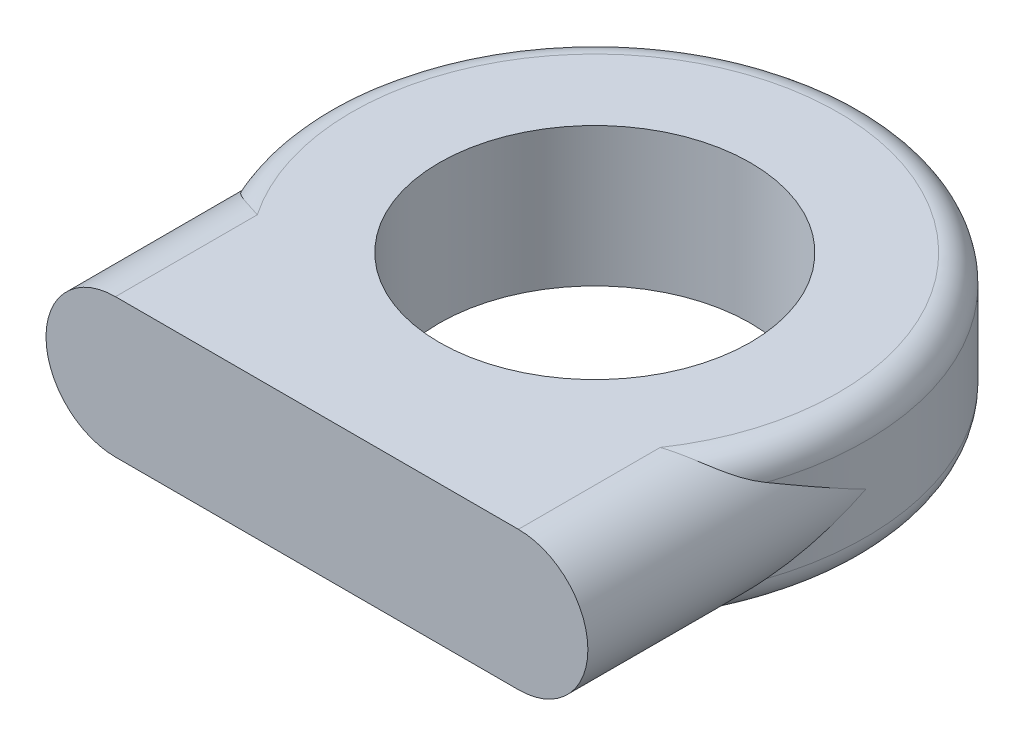
from build123d import *

# Parameters (mm, degrees)
EXTRUDE_1_DEPTH     = 10
SKETCH_2_R          = 9.75
EXTRUDE_2_DEPTH     = 5
FILLET_2_R          = 1
SKETCH_3_R          = 5.6
CUT_EXTRUDE_1_DEPTH = 5


with BuildPart() as part:
    # 草图1 → 凸台-拉伸1 (new body)
    with BuildSketch(Plane.XY):
        with BuildLine():
            Line((-7.25, 2.4999999999999996), (7.249999999999998, 2.500000000000002))
            ThreePointArc((7.249999999999998, 2.500000000000002), (9.75, 4.33e-15), (7.250000000000002, -2.499999999999997))
            Line((7.250000000000002, -2.499999999999997), (-7.25, -2.4999999999999996))
            ThreePointArc((-7.25, -2.4999999999999996), (-9.75, 3.1e-16), (-7.25, 2.4999999999999996))
        make_face()
    extrude(amount=EXTRUDE_1_DEPTH)

    # 草图2 → 凸台-拉伸2 (add)
    with BuildSketch(Plane(origin=(-4.5e-16, 2.500000000000001, 0), x_dir=(1, 1.7e-16, 0), z_dir=(-1.7e-16, 1, 0))):
        Circle(SKETCH_2_R)
    extrude(amount=-EXTRUDE_2_DEPTH)

    # 圆角2
    fillet_2_edges = [part.edges().sort_by_distance(p)[0] for p in [
        (8.304e-14, 2.500000000000001, -9.75),
        (8.387e-14, -2.499999999999999, -9.75),
    ]]
    fillet(fillet_2_edges, radius=FILLET_2_R)

    # 草图3 → 切除-拉伸1 (cut)
    with BuildSketch(Plane(origin=(-4.5e-16, 2.500000000000001, 0), x_dir=(1, 1.7e-16, 0), z_dir=(-1.7e-16, 1, 0))):
        Circle(SKETCH_3_R)
    extrude(amount=-CUT_EXTRUDE_1_DEPTH, mode=Mode.SUBTRACT)


solid = part.part
